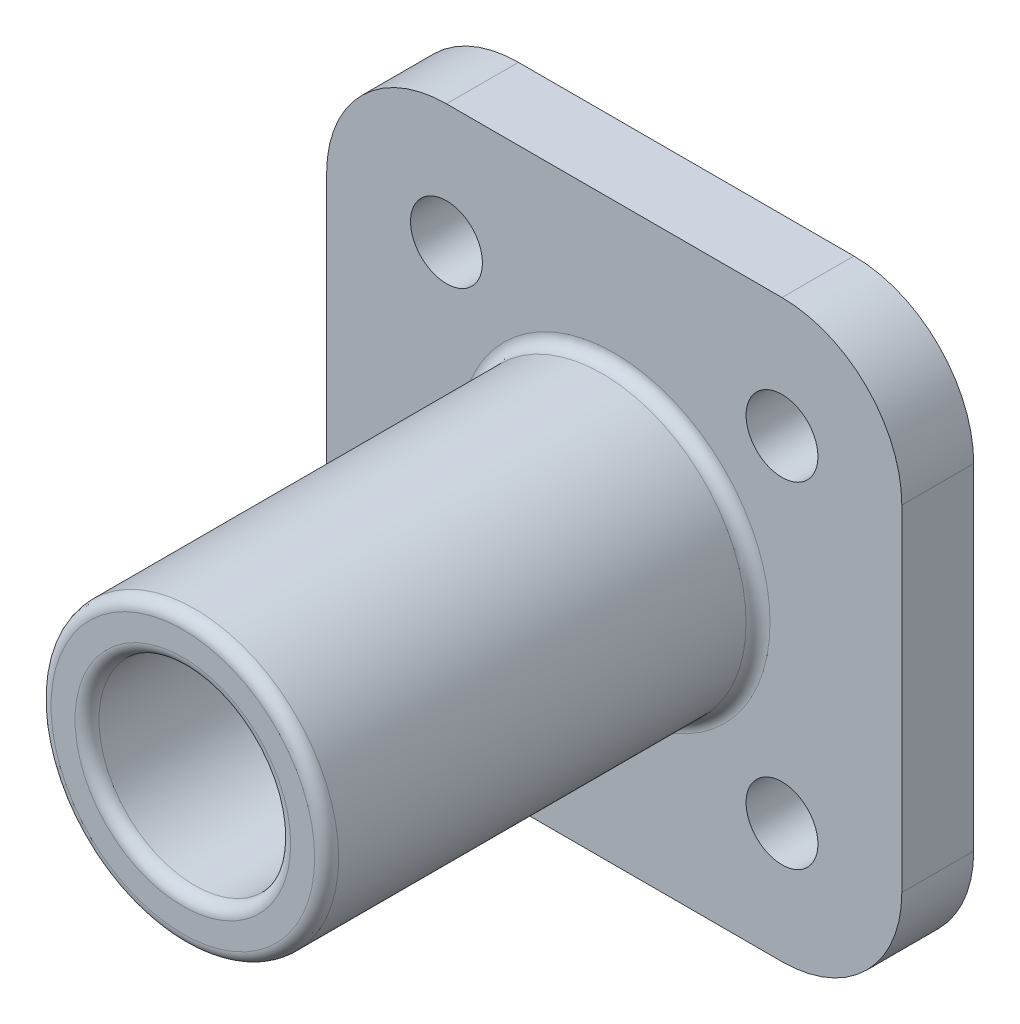
from build123d import *

# Parameters (mm, degrees)
ESQUISSE1_R        = 1.5
BOSS_EXTRU_1_DEPTH = 3
ESQUISSE2_R        = 6
ESQUISSE2_R_2      = 4
BOSS_EXTRU_2_DEPTH = 18
CONG_1_R           = 0.5


with BuildPart() as part:
    # Esquisse1 → Boss.-Extru.1 (new body)
    with BuildSketch(Plane.XY):
        with BuildLine():
            Line((7, -12), (-7, -12))
            ThreePointArc((-7, -12), (-10.535533906, -10.535533906), (-12, -7))
            Line((-12, -7), (-12, 7))
            ThreePointArc((-12, 7), (-10.535533906, 10.535533906), (-7, 12))
            Line((-7, 12), (7, 12))
            ThreePointArc((7, 12), (10.535533906, 10.535533906), (12, 7))
            Line((12, 7), (12, -7))
            ThreePointArc((12, -7), (10.535533906, -10.535533906), (7, -12))
        make_face()
        with Locations((-7, 7)):
            Circle(ESQUISSE1_R, mode=Mode.SUBTRACT)
        with Locations((7, 7)):
            Circle(ESQUISSE1_R, mode=Mode.SUBTRACT)
        with Locations((7, -7)):
            Circle(ESQUISSE1_R, mode=Mode.SUBTRACT)
        with Locations((-7, -7)):
            Circle(ESQUISSE1_R, mode=Mode.SUBTRACT)
    extrude(amount=BOSS_EXTRU_1_DEPTH)

    # Esquisse2 → Boss.-Extru.2 (add)
    with BuildSketch(Plane.XY.offset(3)):
        Circle(ESQUISSE2_R)
        Circle(ESQUISSE2_R_2, mode=Mode.SUBTRACT)
    extrude(amount=BOSS_EXTRU_2_DEPTH)

    # Congé1
    cong_1_edges = [part.edges().sort_by_distance(p)[0] for p in [
        (-6, 0, 3),
        (-6, 0, 21),
        (-4, 0, 21),
    ]]
    fillet(cong_1_edges, radius=CONG_1_R)


solid = part.part
